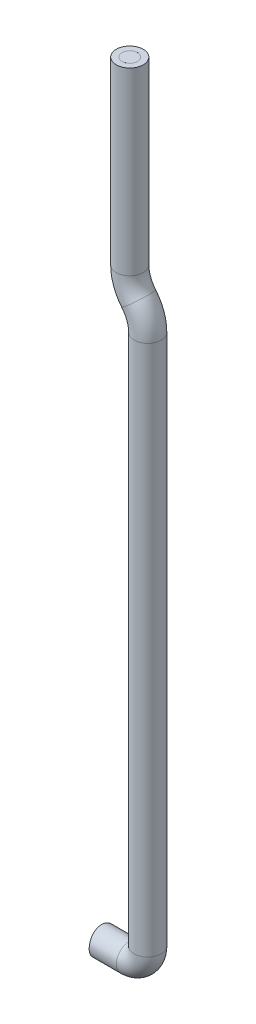
from build123d import *

# Parameters (mm, degrees)
SKETCH_1_R          = 1.05
SKETCH_3_R          = 0.6
SKETCH_4_R          = 0.6
SKETCH_6_R          = 0.6
SKETCH_7_R          = 1.05
SKETCH_7_R_2        = 0.6
CUT_EXTRUDE_1_DEPTH = 10
CUT_EXTRUDE_2_DEPTH = 10


with BuildPart() as part:
    # Sweep 1: sweep along a path in Эскиз2
    with BuildLine(Plane.XY) as sweep_1_path:
        Line((0, 0), (0, 41.34772794))
        ThreePointArc((0, 41.34772794), (-0.180425564, 42.372423017), (-0.7, 43.273863968))
        ThreePointArc((-0.7, 43.273863968), (-1.219574436, 44.17530492), (-1.4, 45.199999997))
        Line((-1.4, 45.199999997), (-1.4, 59.199999997))
    # Эскиз1 → Sweep 1 (sweep)
    with BuildSketch(Plane(origin=(0, 0, 0), x_dir=(1, 0, 0), z_dir=(0, 1, 0))):
        Circle(SKETCH_1_R)
    sweep(path=sweep_1_path.line)

    # Sweep 1 2: sweep along a path in Эскиз2<2>
    with BuildLine(Plane.XY) as sweep_1_2_path:
        Line((0, 0), (0, 41.34772794))
        ThreePointArc((0, 41.34772794), (-0.180425564, 42.372423017), (-0.7, 43.273863968))
        ThreePointArc((-0.7, 43.273863968), (-1.219574436, 44.17530492), (-1.4, 45.199999997))
        Line((-1.4, 45.199999997), (-1.4, 59.199999997))
    # Эскиз3 → Sweep 1 2 (sweep, cut)
    with BuildSketch(Plane.XZ):
        Circle(SKETCH_3_R)
    sweep(path=sweep_1_2_path.line, mode=Mode.SUBTRACT)

    # По траектории4: sweep along a path in Эскиз5<2>
    with BuildLine(Plane.XY) as sweep_4_path:
        Line((-3.6, -1.4), (-1.4, -1.4))
        ThreePointArc((-1.4, -1.4), (-0.410050506, -0.989949494), (0, 0))
    # Эскиз7 → По траектории4 (sweep)
    with BuildSketch(Plane.XZ):
        Circle(SKETCH_7_R)
        Circle(SKETCH_7_R_2, mode=Mode.SUBTRACT)
    sweep(path=sweep_4_path.line)


with BuildPart() as body_2:
    # По траектории2: sweep along a path in Эскиз2<3>
    with BuildLine(Plane.XY) as sweep_2_path:
        Line((0, 0), (0, 41.34772794))
        ThreePointArc((0, 41.34772794), (-0.180425564, 42.372423017), (-0.7, 43.273863968))
        ThreePointArc((-0.7, 43.273863968), (-1.219574436, 44.17530492), (-1.4, 45.199999997))
        Line((-1.4, 45.199999997), (-1.4, 59.199999997))
    # Эскиз4 → По траектории2 (sweep)
    with BuildSketch(Plane.XZ):
        Circle(SKETCH_4_R)
    sweep(path=sweep_2_path.line)

    # По траектории3: sweep along a path in Эскиз5
    with BuildLine(Plane.XY) as sweep_3_path:
        Line((-3.6, -1.4), (-1.4, -1.4))
        ThreePointArc((-1.4, -1.4), (-0.410050506, -0.989949494), (0, 0))
    # Эскиз6 → По траектории3 (sweep)
    with BuildSketch(Plane.XZ):
        Circle(SKETCH_6_R)
    sweep(path=sweep_3_path.line)


with BuildPart() as cut_extrude_1_tool:
    # Эскиз8 → Вырез-Вытянуть1 (new body)
    with BuildSketch(Plane(origin=(0, -2.45, 0), x_dir=(-1, 0, 0), z_dir=(0, -1, 0))):
        with BuildLine():
            ThreePointArc((3.5074106, 1.05), (3.576807827, 0.52703719), (3.6, 0))
            Line((3.6, 0), (3.6, 1.05))
            Line((3.6, 1.05), (3.5074106, 1.05))
        make_face()
    extrude(amount=-CUT_EXTRUDE_1_DEPTH)


with BuildPart() as part_1:
    add(part.part)

    # Вырез-Вытянуть1: cut by cut_extrude_1_tool
    add(cut_extrude_1_tool.part, mode=Mode.SUBTRACT)


with BuildPart() as body_2_1:
    add(body_2.part)

    # Вырез-Вытянуть1: cut by cut_extrude_1_tool
    add(cut_extrude_1_tool.part, mode=Mode.SUBTRACT)


with BuildPart() as cut_extrude_2_tool:
    # Эскиз8<3> → Вырез-Вытянуть2 (new body)
    with BuildSketch(Plane(origin=(0, -2.45, 0), x_dir=(-1, 0, 0), z_dir=(0, -1, 0))):
        with BuildLine():
            Line((3.5074106, -1.05), (3.6, -1.05))
            Line((3.6, -1.05), (3.6, 0))
            ThreePointArc((3.6, 0), (3.576807827, -0.52703719), (3.5074106, -1.05))
        make_face()
    extrude(amount=-CUT_EXTRUDE_2_DEPTH)


with BuildPart() as part_2:
    add(part_1.part)

    # Вырез-Вытянуть2: cut by cut_extrude_2_tool
    add(cut_extrude_2_tool.part, mode=Mode.SUBTRACT)


with BuildPart() as body_2_2:
    add(body_2_1.part)

    # Вырез-Вытянуть2: cut by cut_extrude_2_tool
    add(cut_extrude_2_tool.part, mode=Mode.SUBTRACT)


solid = Compound([part_2.part, body_2_2.part])
